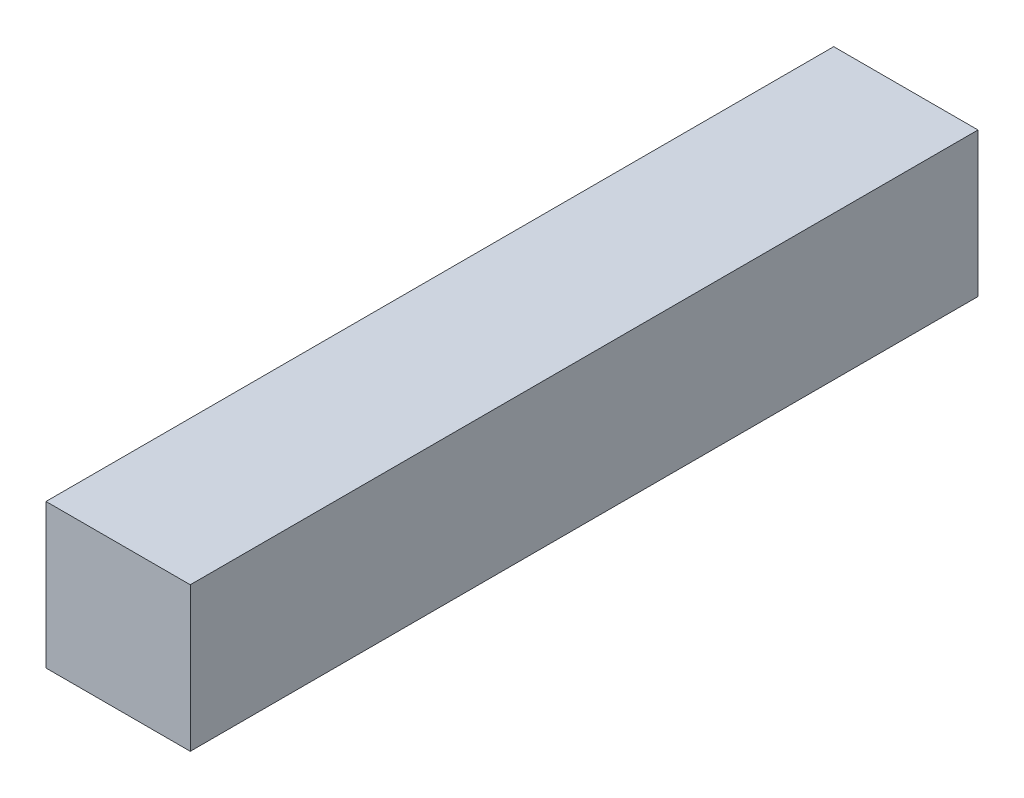
from build123d import *

# Parameters (mm, degrees)
SKETCH1_W           = 25.4
SKETCH1_H           = 25.4
BOSS_EXTRUDE1_DEPTH = 69.341499747


with BuildPart() as part:
    # Sketch1 → Boss-Extrude1 (new, symmetric)
    with BuildSketch(Plane.XY):
        Rectangle(SKETCH1_W, SKETCH1_H)
    extrude(amount=BOSS_EXTRUDE1_DEPTH, both=True)


solid = part.part
